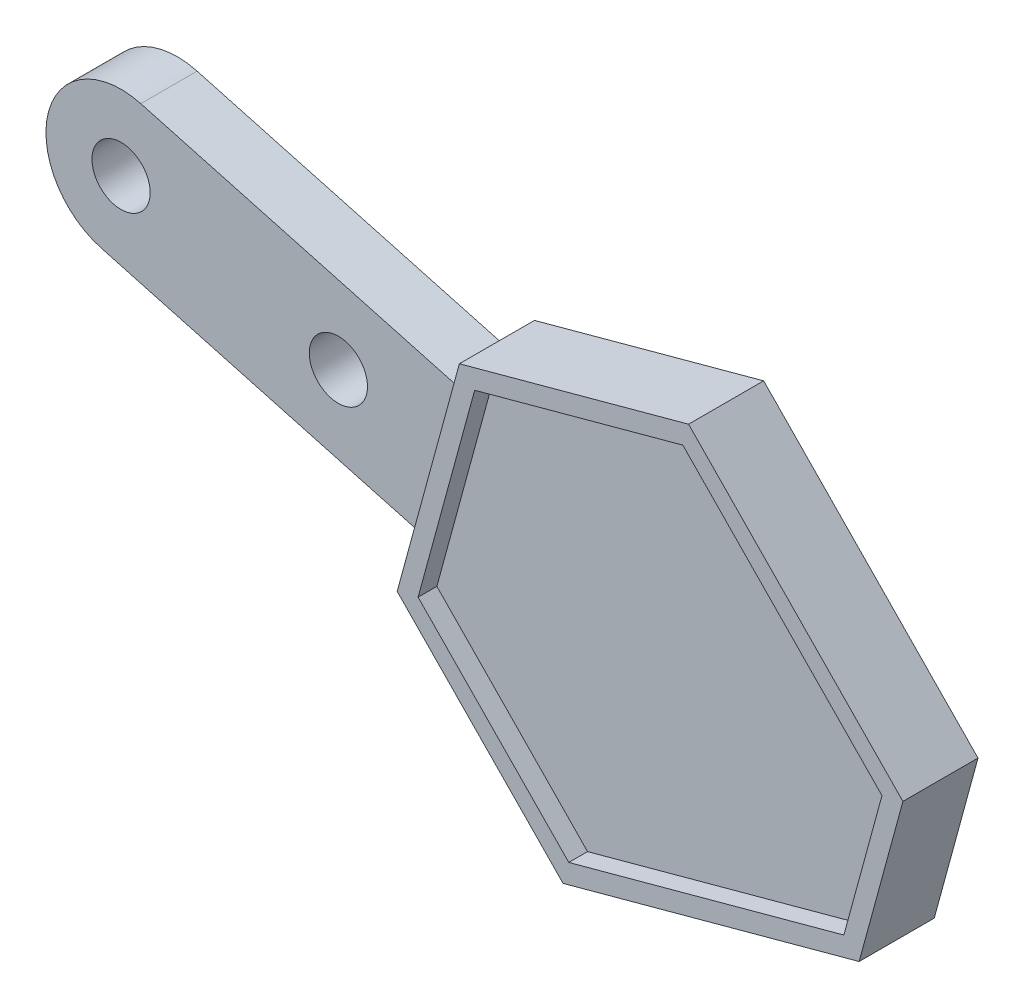
from build123d import *

# Parameters (mm, degrees)
BOSS_EXTRUDE1_DEPTH = 3
FILLET1_R           = 4
BOSS_EXTRUDE2_DEPTH = 1
CUT_EXTRUDE1_REACH  = 72.897
SKETCH5_R           = 1.55


with BuildPart() as part:
    # Sketch1 → Boss-Extrude1 (new body)
    with BuildSketch(Plane.XY):
        Polygon((49.961918802, 33.053079846), (25.841829778, 39.627371101), (24.789943177, 35.768156857), (24.184782156, 33.547911794), (33.022732651, 24.493907566), (48.796245804, 28.776400372), align=None)
        Polygon((27.4988774, 45.706830407), (26.893716379, 43.486585345), (25.841829778, 39.627371101), (49.961918802, 33.053079846), (51.127591799, 37.329759319), (39.708758261, 49.023933188), align=None)
        with BuildLine():
            Line((24.964109257, 44.012528645), (5.668038039, 49.271961649))
            Line((5.668038039, 49.271961649), (4.616151438, 45.412747405))
            ThreePointArc((4.616151438, 45.412747405), (5.002692971, 42.375780391), (7.423479081, 40.501646561))
            Line((7.423479081, 40.501646561), (24.789943177, 35.768156857))
            Line((24.789943177, 35.768156857), (25.841829778, 39.627371101))
            Line((25.841829778, 39.627371101), (26.893716379, 43.486585345))
            Line((26.893716379, 43.486585345), (24.964109257, 44.012528645))
        make_face()
    extrude(amount=BOSS_EXTRUDE1_DEPTH)

    # Fillet1
    fillet1_edges = [part.edges().sort_by_distance(p)[0] for p in [
        (5.668038039, 49.271961649, 1.5),
    ]]
    fillet(fillet1_edges, radius=FILLET1_R - 0.0001)  # a hair under: the kernel refuses the full size

    # Sketch2 → Boss-Extrude2 (add)
    with BuildSketch(Plane.XY.offset(3)):
        Polygon((48.796245804, 28.776400372), (33.022732651, 24.493907566), (24.184782156, 33.547911794), (24.789943177, 35.768156857), (26.893716379, 43.486585345), (27.4988774, 45.706830407), (39.708758261, 49.023933188), (51.127591799, 37.329759319), align=None)
        Polygon((27.85851994, 43.223613694), (25.754746738, 35.505185207), (25.300052744, 33.836981106), (33.327840747, 25.612944712), (47.98193766, 29.591517145), (50.012292821, 37.040585847), (39.40383219, 47.904846429), (28.313213935, 44.891817795), align=None, mode=Mode.SUBTRACT)
    extrude(amount=BOSS_EXTRUDE2_DEPTH)

    # Sketch5 → Cut-Extrude1 (cut, up to next)
    with BuildSketch(Plane.XY.offset(3), mode=Mode.PRIVATE) as cut_extrude1_sk1:
        with Locations((8.475365681, 44.360860805)):
            Circle(SKETCH5_R)
    cut_extrude1_tool1 = extrude(cut_extrude1_sk1.sketch, amount=-CUT_EXTRUDE1_REACH, mode=Mode.PRIVATE) & part.part
    # Sketch5 → Cut-Extrude1 (cut, up to next)
    with BuildSketch(Plane.XY.offset(3), mode=Mode.PRIVATE) as cut_extrude1_sk2:
        with Locations((20.053008413, 41.205201002)):
            Circle(SKETCH5_R)
    cut_extrude1_tool2 = extrude(cut_extrude1_sk2.sketch, amount=-CUT_EXTRUDE1_REACH, mode=Mode.PRIVATE) & part.part
    add(cut_extrude1_tool1.solids().sort_by_distance((8.475366, 44.360861, 3))[0], mode=Mode.SUBTRACT)
    add(cut_extrude1_tool2.solids().sort_by_distance((20.053008, 41.205201, 3))[0], mode=Mode.SUBTRACT)


solid = part.part
